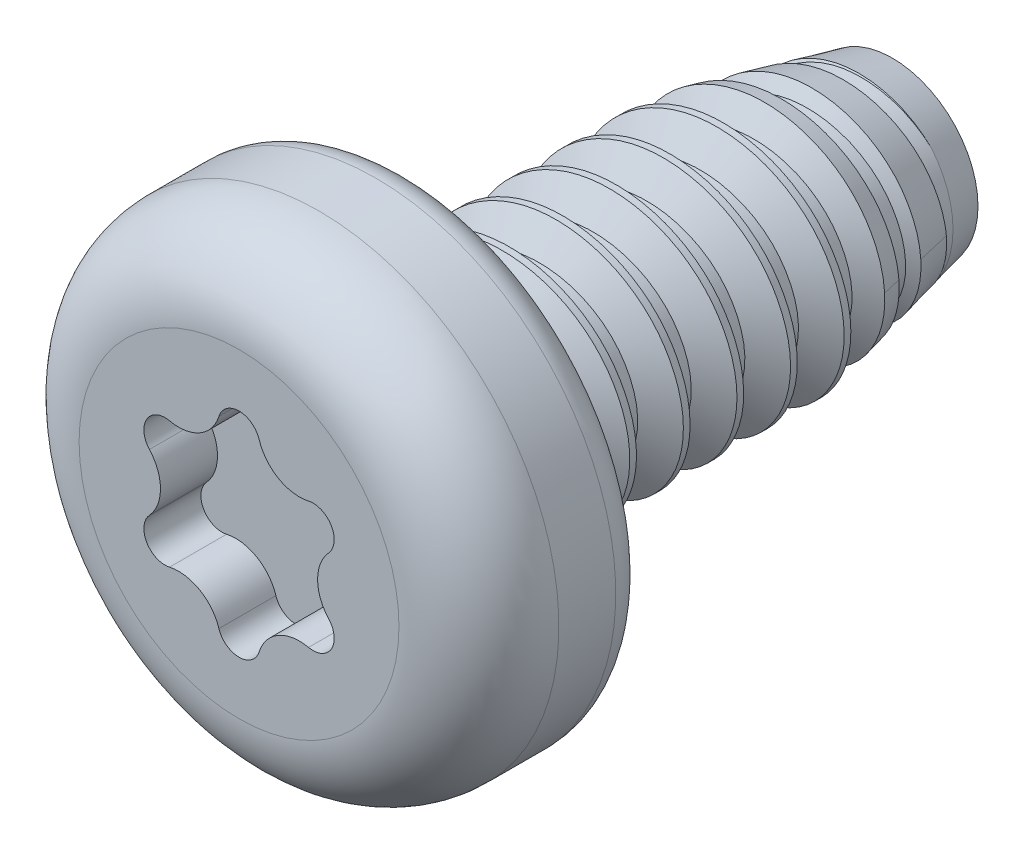
from build123d import *

# Parameters (mm, degrees)
SKETCH1_R           = 4.7371
EXTRUDE3_DEPTH      = 3.3782
SKETCH17_W          = 9.525
SKETCH17_H          = 1.84016028
SWEEP1_PITCH        = 1.058333333
LPATTERN3_COUNT     = 8
LPATTERN3_PITCH     = 1.058333333
LPATTERN3_COL_COUNT = 2
LPATTERN3_COL_PITCH = 1.058333333
CUT_EXTRUDE1_DEPTH  = 1.126066667
CIRPATTERN1_COUNT   = 6


with BuildPart() as part:
    # Sketch1 → Extrude3 (new body)
    with BuildSketch(Plane.XY):
        Circle(SKETCH1_R)
    extrude(amount=EXTRUDE3_DEPTH)

    # Sketch11 → Cut-Revolve3 (revolve, cut)
    with BuildSketch(Plane(origin=(0, 0, 0), x_dir=(0, 0, -1), z_dir=(1, 0, 0))):
        with BuildLine():
            Line((-1.799166667, 4.7371), (-0.67564, 4.7371))
            ThreePointArc((-0.67564, 4.7371), (-0.197890374, 4.539209626), (0, 4.06146))
            Line((0, 4.06146), (0.254, 4.06146))
            Line((0.254, 4.06146), (0.254, 4.9911))
            Line((0.254, 4.9911), (-3.6322, 4.9911))
            Line((-3.6322, 4.9911), (-3.6322, 3.158066667))
            Line((-3.6322, 3.158066667), (-3.3782, 3.158066667))
            ThreePointArc((-3.3782, 3.158066667), (-2.915711844, 4.274611844), (-1.799166667, 4.7371))
        make_face()
    revolve(axis=Axis((0, 0, 0), (0, 0, 1)), mode=Mode.SUBTRACT)

    # Sketch12 → Cut-Extrude1 (cut)
    with BuildSketch(Plane.XY.offset(3.3782)):
        with BuildLine():
            Line((-0.775589968, 1.34336123), (0, 0))
            Line((0, 0), (0.775589968, 1.34336123))
            ThreePointArc((0.775589968, 1.34336123), (0.542421058, 1.54331828), (0.397484923, 1.8141394))
            ThreePointArc((0.397484923, 1.8141394), (0, 2.105377778), (-0.397484923, 1.8141394))
            ThreePointArc((-0.397484923, 1.8141394), (-0.542421058, 1.54331828), (-0.775589968, 1.34336123))
        make_face()
    cut_extrude1 = extrude(amount=-CUT_EXTRUDE1_DEPTH, mode=Mode.SUBTRACT)

    # CirPattern1: Cut-Extrude1 ×6 about axis
    cirpattern1_axis = Axis((0, 0, 0), (0, 0, 1))
    for i in range(1, CIRPATTERN1_COUNT):
        add(cut_extrude1.rotate(cirpattern1_axis, i * 360 / CIRPATTERN1_COUNT), mode=Mode.SUBTRACT)


with BuildPart() as body_2:
    # Sketch17 → Revolve1 (revolve)
    with BuildSketch(Plane(origin=(0, 0, 0), x_dir=(0, 0, -1), z_dir=(1, 0, 0))):
        with Locations((4.7625, 0.92008014)):
            Rectangle(SKETCH17_W, SKETCH17_H)
    revolve(axis=Axis((0, 0, 0), (0, 0, 1)))

    # Sweep1: the profile of Sketch14 profile screwed along a right-hand helix of 1.5 turns, 6 arcs to a turn; built about Z, then put on its axis
    sweep1_z = Axis((0, 0, 0), (0, 0, 1))
    sweep1_corners = [(2.413, 0, -0.066145833), (2.413, 0, 0.066145833), (1.83986028, 0, 0.397048205), (1.83986028, 0, -0.397048205)]
    with BuildLine(mode=Mode.PRIVATE) as sweep1_profile:
        Line(sweep1_corners[0], sweep1_corners[1])
        Line(sweep1_corners[1], sweep1_corners[2])
        Line(sweep1_corners[2], sweep1_corners[3])
        Line(sweep1_corners[3], sweep1_corners[0])
    sweep1_cap = Face(sweep1_profile.wire())
    sweep1_turn_angles = [0, 30, 60, 90, 120, 150, 180, 210, 240, 270, 300, 330, 360]
    sweep1_turn_weights = [1, 0.8660254037844387, 1, 0.8660254037844387, 1, 0.8660254037844387, 1, 0.8660254037844387, 1, 0.8660254037844387, 1, 0.8660254037844387, 1]
    sweep1_turn_rails = [Edge.make_bspline([Vector(p[0], p[1], 0).rotate(sweep1_z, sweep1_turn_angles[k]) / sweep1_turn_weights[k] + Vector(0, 0, p[2] + SWEEP1_PITCH * sweep1_turn_angles[k] / 360) for k in range(13)], [0, 0, 0, 1, 1, 2, 2, 3, 3, 4, 4, 5, 5, 6, 6, 6], 2, sweep1_turn_weights) for p in sweep1_corners]
    sweep1_turn_sides = [Face.make_surface_from_curves(sweep1_turn_rails[p[0]], sweep1_turn_rails[p[1]]) for p in [(0, 1), (1, 2), (2, 3), (3, 0)]]
    sweep1_last_angles = [360, 390, 420, 450, 480, 510, 540]
    sweep1_last_weights = [1, 0.8660254037844387, 1, 0.8660254037844387, 1, 0.8660254037844337, 1]
    sweep1_last_rails = [Edge.make_bspline([Vector(p[0], p[1], 0).rotate(sweep1_z, sweep1_last_angles[k]) / sweep1_last_weights[k] + Vector(0, 0, p[2] + SWEEP1_PITCH * sweep1_last_angles[k] / 360) for k in range(7)], [0, 0, 0, 1, 1, 2, 2, 3, 3, 3], 2, sweep1_last_weights) for p in sweep1_corners]
    sweep1_last_sides = [Face.make_surface_from_curves(sweep1_last_rails[p[0]], sweep1_last_rails[p[1]]) for p in [(0, 1), (1, 2), (2, 3), (3, 0)]]
    sweep1 = Plane(origin=(0, 0, -0.661458333), x_dir=(0, 1, 0), z_dir=(0, 0, -1)) * Solid(Shell([*sweep1_turn_sides, *sweep1_last_sides, sweep1_cap, sweep1_cap.rotate(sweep1_z, 540).moved(Location((0, 0, SWEEP1_PITCH * 540 / 360)))]))
    add(sweep1)

    # LPattern3: Sweep1 ×8
    with Locations(*[(0, 0, -i * LPATTERN3_PITCH) for i in range(1, LPATTERN3_COUNT)]):
        add(sweep1)

    # LPattern3 col: Sweep1 ×2
    with Locations(*[(0, 0, i * LPATTERN3_COL_PITCH) for i in range(1, LPATTERN3_COL_COUNT)]):
        add(sweep1)

    # Sketch13 → Cut-Revolve4 (revolve, cut)
    with BuildSketch(Plane(origin=(0, 0, 0), x_dir=(0, 0, -1), z_dir=(1, 0, 0)), mode=Mode.PRIVATE) as cut_revolve4_sk:
        Polygon((9.525, 1.6891), (6.43636, 2.413), (9.525, 2.413), (12.065, 2.413), (12.065, 0), (9.525, 0), align=None)
    revolve(cut_revolve4_sk.sketch.rotate(Axis((0, 0, 0), (0, 0, -1)), 90), axis=Axis((0, 0, 0), (0, 0, -1)), mode=Mode.SUBTRACT)


with BuildPart() as part_1:
    add(part.part)

    # Combine1: union body 2
    add(body_2.part)


solid = part_1.part
